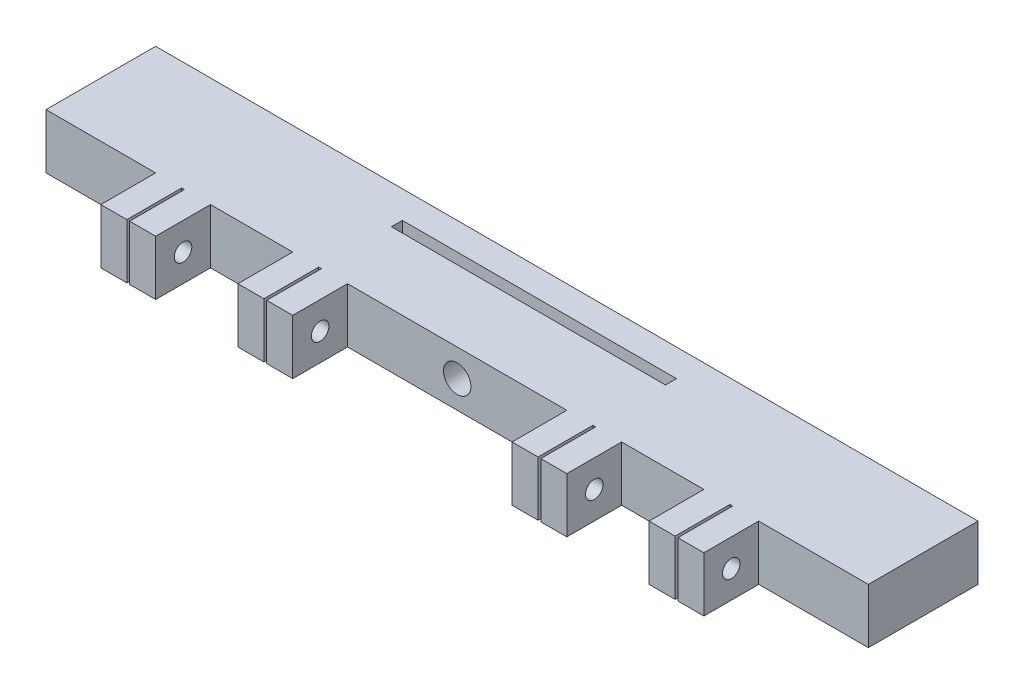
from build123d import *

# Parameters (mm, degrees)
BOSS_EXTRUDE1_DEPTH     = 10
CUT_EXTRUDE1_DEPTH      = 82.39410298
CUT_EXTRUDE1_DEPTH_BACK = 82.39410298
SKETCH2_W               = 0.5
SKETCH2_H               = 10
CUT_EXTRUDE2_DEPTH      = 134.790881603
CUT_EXTRUDE2_DEPTH_BACK = 134.790881603
SKETCH3_R               = 1.6
CUT_EXTRUDE3_DEPTH      = 82.39410298
CUT_EXTRUDE3_DEPTH_BACK = 82.39410298
SKETCH4_W               = 50
SKETCH4_H               = 2
SKETCH5_R               = 2.5
CUT_EXTRUDE4_DEPTH      = 8


with BuildPart() as part:
    # Sketch1 → Boss-Extrude1 (new body)
    with BuildSketch(Plane(origin=(0, 0, 0), x_dir=(1, 0, 0), z_dir=(0, 1, 0))):
        Polygon((0, 0), (-75, 0), (-75, -20), (-55, -20), (-55, -30), (-45, -30), (-45, -20), (-30, -20), (-30, -30), (-20, -30), (-20, -20), (20, -20), (20, -30), (30, -30), (30, -20), (45, -20), (45, -30), (55, -30), (55, -20), (75, -20), (75, 0), align=None)
    extrude(amount=BOSS_EXTRUDE1_DEPTH)

    # Sketch2 → Cut-Extrude1 (cut, two sides: drawn at the far end of the back side and taken through both)
    with BuildSketch(Plane(origin=(0, 10, 0), x_dir=(1, 0, 0), z_dir=(0, 1, 0)).offset(-CUT_EXTRUDE1_DEPTH_BACK)):
        with Locations((-50, -25)):
            Rectangle(SKETCH2_W, SKETCH2_H)
        with Locations((-25, -25)):
            Rectangle(SKETCH2_W, SKETCH2_H)
        with Locations((25, -25)):
            Rectangle(SKETCH2_W, SKETCH2_H)
        with Locations((50, -25)):
            Rectangle(SKETCH2_W, SKETCH2_H)
    extrude(amount=CUT_EXTRUDE1_DEPTH + CUT_EXTRUDE1_DEPTH_BACK, mode=Mode.SUBTRACT)

    # Sketch3 → Cut-Extrude2 (cut, two sides: drawn at the far end of the back side and taken through both)
    with BuildSketch(Plane.ZY.offset(55).offset(-CUT_EXTRUDE2_DEPTH_BACK)):
        with Locations((25, 5)):
            Circle(SKETCH3_R)
    extrude(amount=CUT_EXTRUDE2_DEPTH + CUT_EXTRUDE2_DEPTH_BACK, mode=Mode.SUBTRACT)

    # Sketch4 → Cut-Extrude3 (cut, two sides: drawn at the far end of the back side and taken through both)
    with BuildSketch(Plane(origin=(0, 10, 0), x_dir=(1, 0, 0), z_dir=(0, 1, 0)).offset(-CUT_EXTRUDE3_DEPTH_BACK)):
        with Locations((0, -6)):
            Rectangle(SKETCH4_W, SKETCH4_H)
    extrude(amount=CUT_EXTRUDE3_DEPTH + CUT_EXTRUDE3_DEPTH_BACK, mode=Mode.SUBTRACT)

    # Sketch5 → Cut-Extrude4 (cut)
    with BuildSketch(Plane.XY.offset(20)):
        with Locations((0, 5)):
            Circle(SKETCH5_R)
    extrude(amount=-CUT_EXTRUDE4_DEPTH, mode=Mode.SUBTRACT)


solid = part.part
